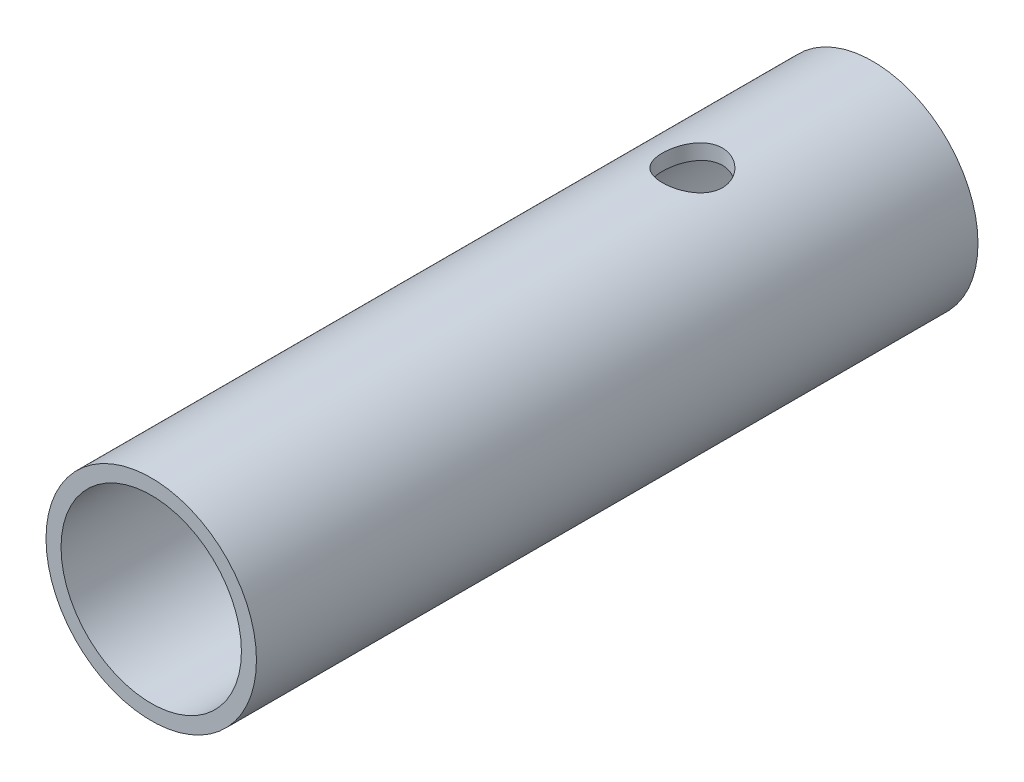
from build123d import *

# Parameters (mm, degrees)
SKETCH1_R           = 22.225
SKETCH1_R_2         = 19.05
BOSS_EXTRUDE1_DEPTH = 152.4
CUT_EXTRUDE2_START  = 17
CUT_EXTRUDE2_DEPTH  = 6


with BuildPart() as part:
    # Sketch1 → Boss-Extrude1 (new body)
    with BuildSketch(Plane.XY):
        with Locations(Location((0, 0, 0), (0, 0, 180))):
            Circle(SKETCH1_R)
        with Locations(Location((0, 0, 0), (0, 0, 180))):
            Circle(SKETCH1_R_2, mode=Mode.SUBTRACT)
    extrude(amount=BOSS_EXTRUDE1_DEPTH)

    # Cut-Extrude2: read off the stored shape, not the designer's step
    # Cut-Extrude2 outline → Cut-Extrude2 (cut)
    with BuildSketch(Plane(origin=(0, 0, 0), x_dir=(1, 0, 0), z_dir=(0, 1, 0)).offset(CUT_EXTRUDE2_START)):
        with BuildLine():
            add(Edge.make_bspline(
                [(0, -31.75), (-0.843742977, -31.75), (-1.67135416, -31.917681707), (-3.207407391, -32.556803988), (-3.908974771, -33.028428985), (-5.655787185, -34.776111227), (-6.348899568, -36.429534298), (-6.35109767, -39.76208898), (-5.663545224, -41.416666002), (-3.903548324, -43.176730242), (-3.20362184, -43.644982836), (-1.672372727, -44.281682376), (-0.83422503, -44.449644915), (0.828810532, -44.450353931), (1.668517725, -44.282672927), (3.199496011, -43.647307562), (3.901623248, -43.178008083), (5.659966961, -41.421534924), (6.34938922, -39.776997076), (6.350609937, -36.427631593), (5.656619925, -34.777684483), (3.328721052, -32.447147133), (1.687485953, -31.75), (0, -31.75)],
                knots=[0, 0, 0, 0, 0.0625, 0.0625, 0.125, 0.125, 0.25, 0.25, 0.375, 0.375, 0.4375, 0.4375, 0.5, 0.5, 0.5625, 0.5625, 0.625, 0.625, 0.75, 0.75, 0.875, 0.875, 1, 1, 1, 1], degree=3))
        make_face()
    extrude(amount=CUT_EXTRUDE2_DEPTH, mode=Mode.SUBTRACT)


solid = part.part
